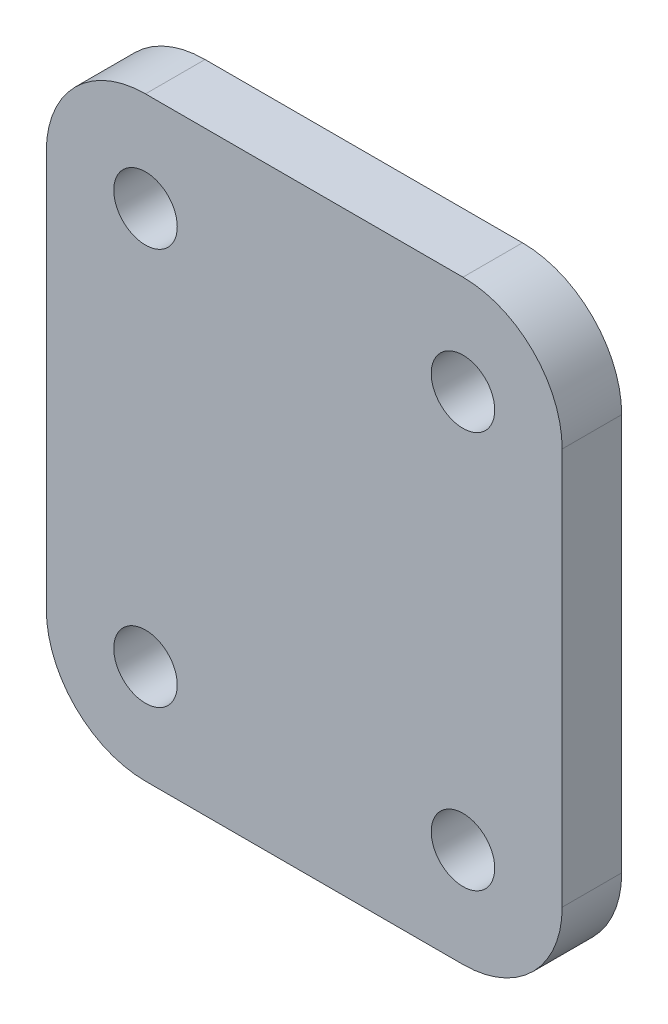
from build123d import *

# Parameters (mm, degrees)
ESBO_O1_W                = 26
ESBO_O1_H                = 30
ESBO_O1_R                = 1.6
RESSALTO_EXTRUS_O1_DEPTH = 3
FILETE1_R                = 5


with BuildPart() as part:
    # Esboço1 → Ressalto-extrusão1 (new body)
    with BuildSketch(Plane.XY):
        Rectangle(ESBO_O1_W, ESBO_O1_H)
        with Locations((-8, -10)):
            Circle(ESBO_O1_R, mode=Mode.SUBTRACT)
        with Locations((8, -10)):
            Circle(ESBO_O1_R, mode=Mode.SUBTRACT)
        with Locations((-8, 10)):
            Circle(ESBO_O1_R, mode=Mode.SUBTRACT)
        with Locations((8, 10)):
            Circle(ESBO_O1_R, mode=Mode.SUBTRACT)
    extrude(amount=RESSALTO_EXTRUS_O1_DEPTH)

    # Filete1
    filete1_edges = [part.edges().sort_by_distance(p)[0] for p in [
        (-13, -15, 1.5),
        (13, -15, 1.5),
        (-13, 15, 1.5),
        (13, 15, 1.5),
    ]]
    fillet(filete1_edges, radius=FILETE1_R)


solid = part.part
